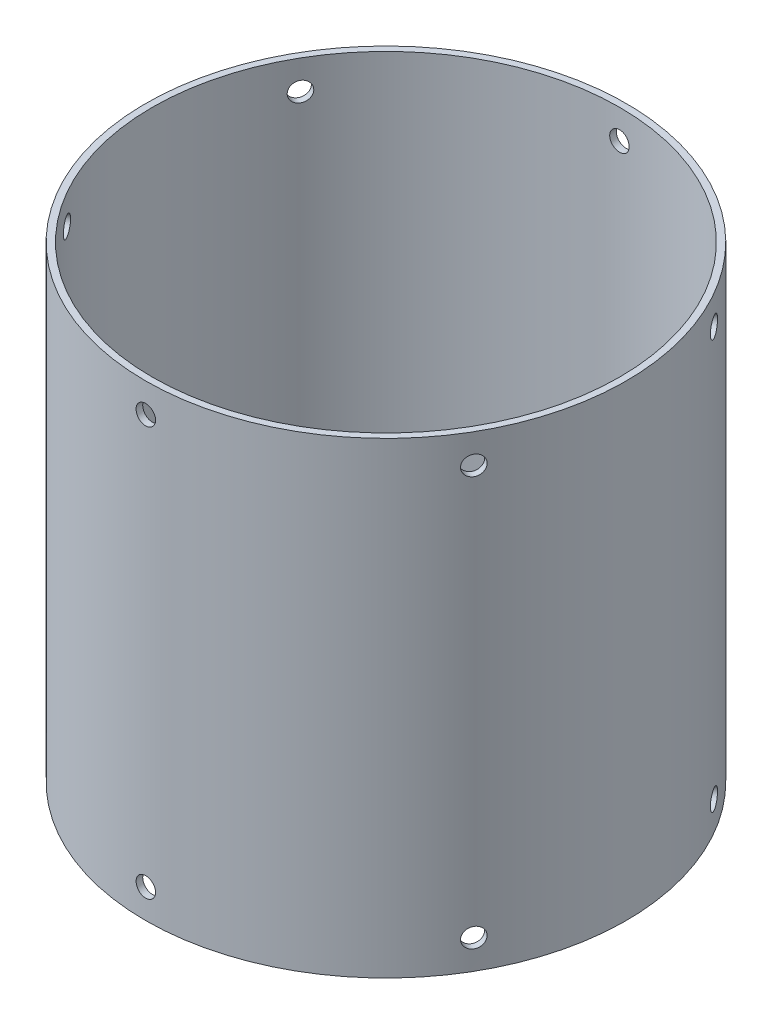
from build123d import *

# Parameters (mm, degrees)
SKETCH1_R           = 78.359
SKETCH1_R_2         = 76.2
BOSS_EXTRUDE1_DEPTH = 152.4
SKETCH2_R           = 3.175
CUT_EXTRUDE1_DEPTH  = 189.430426848
CIRPATTERN1_COUNT   = 6


with BuildPart() as part:
    # Sketch1 → Boss-Extrude1 (new body)
    with BuildSketch(Plane(origin=(0, 0, 0), x_dir=(1, 0, 0), z_dir=(0, 1, 0))):
        Circle(SKETCH1_R)
        Circle(SKETCH1_R_2, mode=Mode.SUBTRACT)
    extrude(amount=BOSS_EXTRUDE1_DEPTH)

    # Sketch2 → Cut-Extrude1 (cut, through all)
    with BuildSketch(Plane.XY):
        with Locations((0, 9.525)):
            Circle(SKETCH2_R)
        with Locations((0, 142.875)):
            Circle(SKETCH2_R)
    cut_extrude1 = extrude(amount=-CUT_EXTRUDE1_DEPTH, mode=Mode.SUBTRACT)

    # CirPattern1: Cut-Extrude1 ×6 about axis
    cirpattern1_axis = Axis((0, 0, 0), (0, 1, 0))
    for i in range(1, CIRPATTERN1_COUNT):
        add(cut_extrude1.rotate(cirpattern1_axis, i * 360 / CIRPATTERN1_COUNT), mode=Mode.SUBTRACT)


solid = part.part
